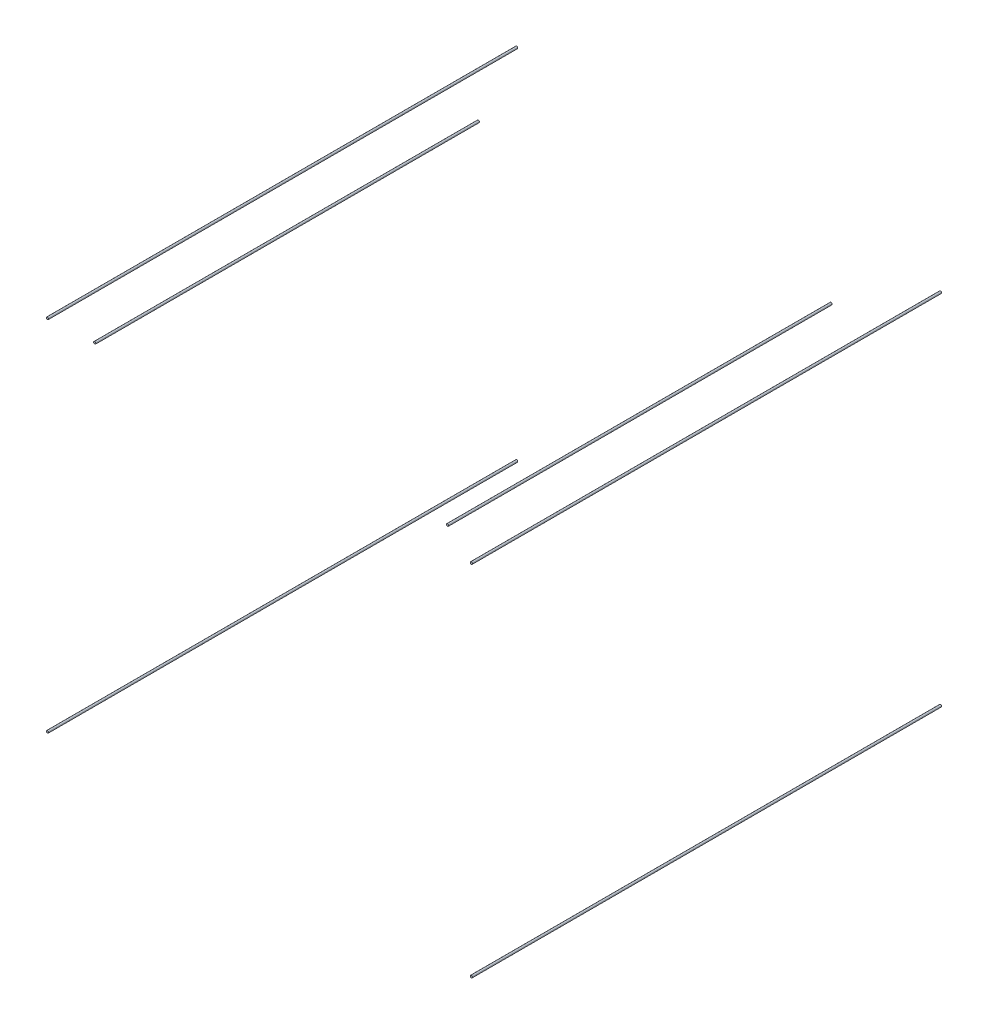
from build123d import *

# Parameters (mm, degrees)
SKETCH1_R      = 0.15
LINE_1_DEPTH   = 64.2
LINE_1_2_DEPTH = 64.2
LINE_1_3_DEPTH = 64.2
LINE_1_4_DEPTH = 64.2
SKETCH2_R      = 0.15
LINE_2_DEPTH   = 52.5
LINE_2_2_DEPTH = 52.5


with BuildPart() as part:
    # Sketch1 → Line_1 (new body)
    with BuildSketch(Plane.XY):
        with Locations((3.5, 3.5)):
            Circle(SKETCH1_R)
    extrude(amount=LINE_1_DEPTH)


with BuildPart() as body_2:
    # Sketch1 → Line_1 2 (new body)
    with BuildSketch(Plane.XY):
        with Locations((61.5, 3.5)):
            Circle(SKETCH1_R)
    extrude(amount=LINE_1_2_DEPTH)


with BuildPart() as body_3:
    # Sketch1 → Line_1 3 (new body)
    with BuildSketch(Plane.XY):
        with Locations((3.5, 52.5)):
            Circle(SKETCH1_R)
    extrude(amount=LINE_1_3_DEPTH)


with BuildPart() as body_4:
    # Sketch1 → Line_1 4 (new body)
    with BuildSketch(Plane.XY):
        with Locations((61.5, 52.5)):
            Circle(SKETCH1_R)
    extrude(amount=LINE_1_4_DEPTH)


with BuildPart() as body_5:
    # Sketch2 → Line_2 (new body)
    with BuildSketch(Plane.XY.offset(10.1)):
        with Locations((8.37, 51.23)):
            Circle(SKETCH2_R)
    extrude(amount=LINE_2_DEPTH)


with BuildPart() as body_6:
    # Sketch2 → Line_2 2 (new body)
    with BuildSketch(Plane.XY.offset(10.1)):
        with Locations((56.63, 53.77)):
            Circle(SKETCH2_R)
    extrude(amount=LINE_2_2_DEPTH)


solid = Compound([part.part, body_2.part, body_3.part, body_4.part, body_5.part, body_6.part])
